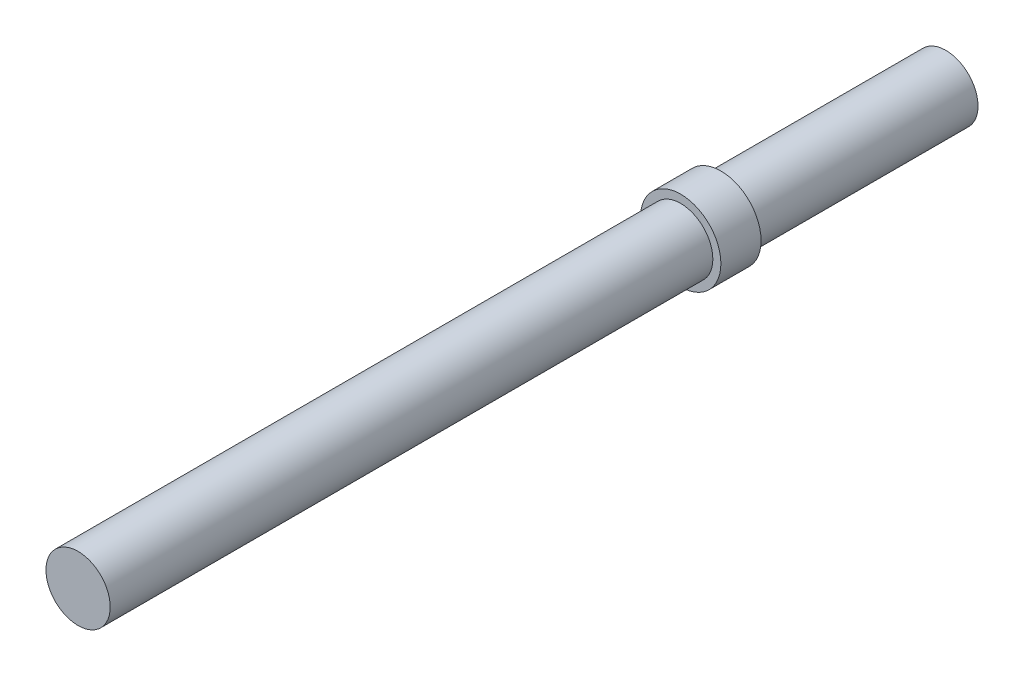
from build123d import *

# Parameters (mm, degrees)
CROQUIS1_R              = 4
SALIENTE_EXTRUIR1_DEPTH = 54
CROQUIS2_R              = 5
SALIENTE_EXTRUIR2_DEPTH = 5


with BuildPart() as part:
    # Croquis1 → Saliente-Extruir1 (new, symmetric)
    with BuildSketch(Plane.XY):
        Circle(CROQUIS1_R)
    extrude(amount=SALIENTE_EXTRUIR1_DEPTH, both=True)

    # Croquis2 → Saliente-Extruir2 (add)
    with BuildSketch(Plane.XY.offset(-26)):
        Circle(CROQUIS2_R)
    extrude(amount=SALIENTE_EXTRUIR2_DEPTH)


solid = part.part
